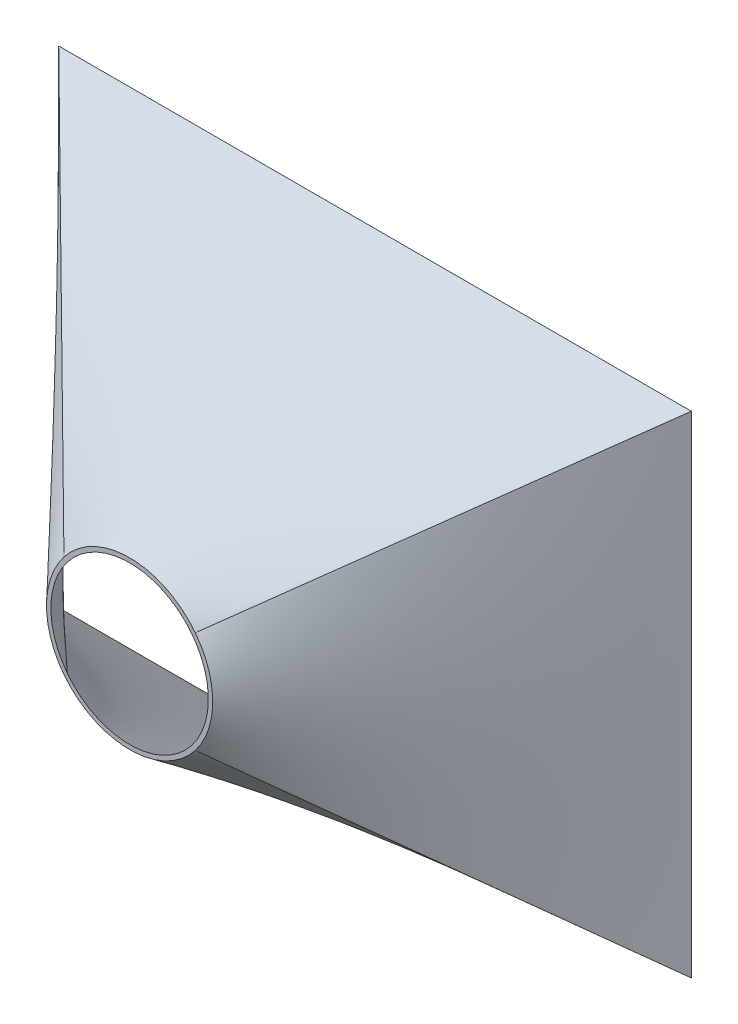
from build123d import *


with BuildPart() as part:
    # Sketch1 → Loft1 section 0
    with BuildSketch(Plane.XY):
        with BuildLine():
            Line((0, 0), (0, 450))
            Line((0, 450), (580, 450))
            Line((580, 450), (580, 0))
            Line((580, 0), (0, 0))
        make_face()
    # Sketch2 for Loft1 → Loft1 section 1
    with BuildSketch(Plane.XY.offset(225)):
        with BuildLine():
            # circular arc as an exact rational Bezier (weights 1, cos(half-angle), 1)
            Bezier((229.795511203, 178.289620761), (193.554699724, 225), (229.795511203, 271.710379239), weights=[1, 0.790085155, 1])
            Bezier((229.795511203, 271.710379239), (290, 349.307275912), (350.204488797, 271.710379239), weights=[1, 0.612997103, 1])
            Bezier((350.204488797, 271.710379239), (386.445300276, 225), (350.204488797, 178.289620761), weights=[1, 0.790085155, 1])
            Bezier((350.204488797, 178.289620761), (290, 100.692724088), (229.795511203, 178.289620761), weights=[1, 0.612997103, 1])
        make_face()
    loft()

    # Cut-Loft2: read off the stored shape, not the designer's step
    # Cut-Loft2: loft between two sections, ruled curve by curve
    cut_loft2_from = [
        Edge.make_bspline([(576, 446, 0), (564.083333333, 446, 0), (552.166666667, 446, 0), (528.333333333, 446, 0), (516.416666667, 446, 0), (492.583333333, 446, 0), (480.666666667, 446, 0), (456.833333333, 446, 0), (444.916666667, 446, 0), (421.083333333, 446, 0), (409.166666667, 446, 0), (385.333333333, 446, 0), (373.416666667, 446, 0), (349.583333333, 446, 0), (337.666666667, 446, 0), (313.833333333, 446, 0), (301.916666667, 446, 0), (278.083333333, 446, 0), (266.166666667, 446, 0), (242.333333333, 446, 0), (230.416666667, 446, 0), (206.583333333, 446, 0), (194.666666667, 446, 0), (170.833333333, 446, 0), (158.916666667, 446, 0), (135.083333333, 446, 0), (123.166666667, 446, 0), (99.333333333, 446, 0), (87.416666667, 446, 0), (63.583333333, 446, 0), (51.666666667, 446, 0), (27.833333333, 446, 0), (15.916666667, 446, 0), (4, 446, 0)], [0, 0, 0, 0, 0.0625, 0.0625, 0.125, 0.125, 0.1875, 0.1875, 0.25, 0.25, 0.3125, 0.3125, 0.375, 0.375, 0.4375, 0.4375, 0.5, 0.5, 0.5625, 0.5625, 0.625, 0.625, 0.6875, 0.6875, 0.75, 0.75, 0.8125, 0.8125, 0.875, 0.875, 0.9375, 0.9375, 1, 1, 1, 1], 3),
        Edge.make_bspline([(4, 446, 0), (4, 427.583333333, 0), (4, 409.166666667, 0), (4, 372.333333333, 0), (4, 353.916666667, 0), (4, 317.083333333, 0), (4, 298.666666667, 0), (4, 261.833333333, 0), (4, 243.416666667, 0), (4, 206.583333333, 0), (4, 188.166666667, 0), (4, 151.333333333, 0), (4, 132.916666667, 0), (4, 96.083333333, 0), (4, 77.666666667, 0), (4, 40.833333333, 0), (4, 22.416666667, 0), (4, 4, 0)], [0, 0, 0, 0, 0.125, 0.125, 0.25, 0.25, 0.375, 0.375, 0.5, 0.5, 0.625, 0.625, 0.75, 0.75, 0.875, 0.875, 1, 1, 1, 1], 3),
        Edge.make_bspline([(576, 4, 0), (576, 22.416666667, 0), (576, 40.833333333, 0), (576, 77.666666667, 0), (576, 96.083333333, 0), (576, 132.916666667, 0), (576, 151.333333333, 0), (576, 188.166666667, 0), (576, 206.583333333, 0), (576, 243.416666667, 0), (576, 261.833333333, 0), (576, 298.666666667, 0), (576, 317.083333333, 0), (576, 353.916666667, 0), (576, 372.333333333, 0), (576, 409.166666667, 0), (576, 427.583333333, 0), (576, 446, 0)], [0, 0, 0, 0, 0.125, 0.125, 0.25, 0.25, 0.375, 0.375, 0.5, 0.5, 0.625, 0.625, 0.75, 0.75, 0.875, 0.875, 1, 1, 1, 1], 3),
        Edge.make_bspline([(4, 4, 0), (15.916666667, 4, 0), (27.833333333, 4, 0), (51.666666667, 4, 0), (63.583333333, 4, 0), (87.416666667, 4, 0), (99.333333333, 4, 0), (123.166666667, 4, 0), (135.083333333, 4, 0), (158.916666667, 4, 0), (170.833333333, 4, 0), (194.666666667, 4, 0), (206.583333333, 4, 0), (230.416666667, 4, 0), (242.333333333, 4, 0), (266.166666667, 4, 0), (278.083333333, 4, 0), (301.916666667, 4, 0), (313.833333333, 4, 0), (337.666666667, 4, 0), (349.583333333, 4, 0), (373.416666667, 4, 0), (385.333333333, 4, 0), (409.166666667, 4, 0), (421.083333333, 4, 0), (444.916666667, 4, 0), (456.833333333, 4, 0), (480.666666667, 4, 0), (492.583333333, 4, 0), (516.416666667, 4, 0), (528.333333333, 4, 0), (552.166666667, 4, 0), (564.083333333, 4, 0), (576, 4, 0)], [0, 0, 0, 0, 0.0625, 0.0625, 0.125, 0.125, 0.1875, 0.1875, 0.25, 0.25, 0.3125, 0.3125, 0.375, 0.375, 0.4375, 0.4375, 0.5, 0.5, 0.5625, 0.5625, 0.625, 0.625, 0.6875, 0.6875, 0.75, 0.75, 0.8125, 0.8125, 0.875, 0.875, 0.9375, 0.9375, 1, 1, 1, 1], 3),
    ]
    cut_loft2_to = [
        Edge.make_bspline([(347.130777101, 269.146509578, 225), (345.67525748, 271.030123204, 225), (344.090894703, 272.887735344, 225), (340.657527063, 276.506067972, 225), (338.808446099, 278.266722873, 225), (334.848141695, 281.6414368, 225), (332.736859461, 283.255398207, 225), (328.266345603, 286.284723799, 225), (325.90708719, 287.699963514, 225), (320.967848708, 290.280905949, 225), (318.387886703, 291.446469996, 225), (313.047680491, 293.48218681, 225), (310.287505998, 294.352205924, 225), (304.639227705, 295.760189219, 225), (301.751242441, 296.298047084, 225), (295.908763417, 297.017982003, 225), (292.95442333, 297.2, 225), (287.04557667, 297.2, 225), (284.091236583, 297.017982003, 225), (278.248757559, 296.298047084, 225), (275.360772295, 295.760189219, 225), (269.712494002, 294.352205924, 225), (266.952319509, 293.48218681, 225), (261.612113297, 291.446469996, 225), (259.032151292, 290.280905949, 225), (254.09291281, 287.699963514, 225), (251.733654397, 286.284723799, 225), (247.263140539, 283.255398207, 225), (245.151858305, 281.6414368, 225), (241.191553901, 278.266722873, 225), (239.342472937, 276.506067972, 225), (235.909105297, 272.887735344, 225), (234.32474252, 271.030123204, 225), (232.869222899, 269.146509578, 225)], [0, 0, 0, 0, 0.0625, 0.0625, 0.125, 0.125, 0.1875, 0.1875, 0.25, 0.25, 0.3125, 0.3125, 0.375, 0.375, 0.4375, 0.4375, 0.5, 0.5, 0.5625, 0.5625, 0.625, 0.625, 0.6875, 0.6875, 0.75, 0.75, 0.8125, 0.8125, 0.875, 0.875, 0.9375, 0.9375, 1, 1, 1, 1], 3),
        Edge.make_bspline([(232.869222899, 269.146509578, 225), (230.619783486, 266.235470337, 225), (228.53431882, 263.074533519, 225), (224.829593326, 256.31322659, 225), (223.211042232, 252.712908785, 225), (220.563364718, 245.182266319, 225), (219.534906142, 241.252361475, 225), (218.153019223, 233.214624715, 225), (217.8, 229.107527049, 225), (217.8, 220.892472951, 225), (218.153019223, 216.785375285, 225), (219.534906142, 208.747638525, 225), (220.563364718, 204.817733681, 225), (223.211042232, 197.287091215, 225), (224.829593326, 193.68677341, 225), (228.53431882, 186.925466481, 225), (230.619783486, 183.764529663, 225), (232.869222899, 180.853490422, 225)], [0, 0, 0, 0, 0.125, 0.125, 0.25, 0.25, 0.375, 0.375, 0.5, 0.5, 0.625, 0.625, 0.75, 0.75, 0.875, 0.875, 1, 1, 1, 1], 3),
        Edge.make_bspline([(347.130777101, 180.853490422, 225), (349.380216514, 183.764529663, 225), (351.46568118, 186.925466481, 225), (355.170406674, 193.68677341, 225), (356.788957768, 197.287091215, 225), (359.436635282, 204.817733681, 225), (360.465093858, 208.747638525, 225), (361.846980777, 216.785375285, 225), (362.2, 220.892472951, 225), (362.2, 229.107527049, 225), (361.846980777, 233.214624715, 225), (360.465093858, 241.252361475, 225), (359.436635282, 245.182266319, 225), (356.788957768, 252.712908785, 225), (355.170406674, 256.31322659, 225), (351.46568118, 263.074533519, 225), (349.380216514, 266.235470337, 225), (347.130777101, 269.146509578, 225)], [0, 0, 0, 0, 0.125, 0.125, 0.25, 0.25, 0.375, 0.375, 0.5, 0.5, 0.625, 0.625, 0.75, 0.75, 0.875, 0.875, 1, 1, 1, 1], 3),
        Edge.make_bspline([(232.869222899, 180.853490422, 225), (234.32474252, 178.969876796, 225), (235.909105297, 177.112264656, 225), (239.342472937, 173.493932028, 225), (241.191553901, 171.733277127, 225), (245.151858305, 168.3585632, 225), (247.263140539, 166.744601793, 225), (251.733654397, 163.715276201, 225), (254.09291281, 162.300036486, 225), (259.032151292, 159.719094051, 225), (261.612113297, 158.553530004, 225), (266.952319509, 156.51781319, 225), (269.712494002, 155.647794076, 225), (275.360772295, 154.239810781, 225), (278.248757559, 153.701952916, 225), (284.091236583, 152.982017997, 225), (287.04557667, 152.8, 225), (292.95442333, 152.8, 225), (295.908763417, 152.982017997, 225), (301.751242441, 153.701952916, 225), (304.639227705, 154.239810781, 225), (310.287505998, 155.647794076, 225), (313.047680491, 156.51781319, 225), (318.387886703, 158.553530004, 225), (320.967848708, 159.719094051, 225), (325.90708719, 162.300036486, 225), (328.266345603, 163.715276201, 225), (332.736859461, 166.744601793, 225), (334.848141695, 168.3585632, 225), (338.808446099, 171.733277127, 225), (340.657527063, 173.493932028, 225), (344.090894703, 177.112264656, 225), (345.67525748, 178.969876796, 225), (347.130777101, 180.853490422, 225)], [0, 0, 0, 0, 0.0625, 0.0625, 0.125, 0.125, 0.1875, 0.1875, 0.25, 0.25, 0.3125, 0.3125, 0.375, 0.375, 0.4375, 0.4375, 0.5, 0.5, 0.5625, 0.5625, 0.625, 0.625, 0.6875, 0.6875, 0.75, 0.75, 0.8125, 0.8125, 0.875, 0.875, 0.9375, 0.9375, 1, 1, 1, 1], 3),
    ]
    cut_loft2 = Solid(Shell([*[Face.make_surface_from_curves(cut_loft2_from[k], cut_loft2_to[k]) for k in range(4)], Face(Wire(cut_loft2_from)), Face(Wire(cut_loft2_to))]))
    add(cut_loft2, mode=Mode.SUBTRACT)


solid = part.part
